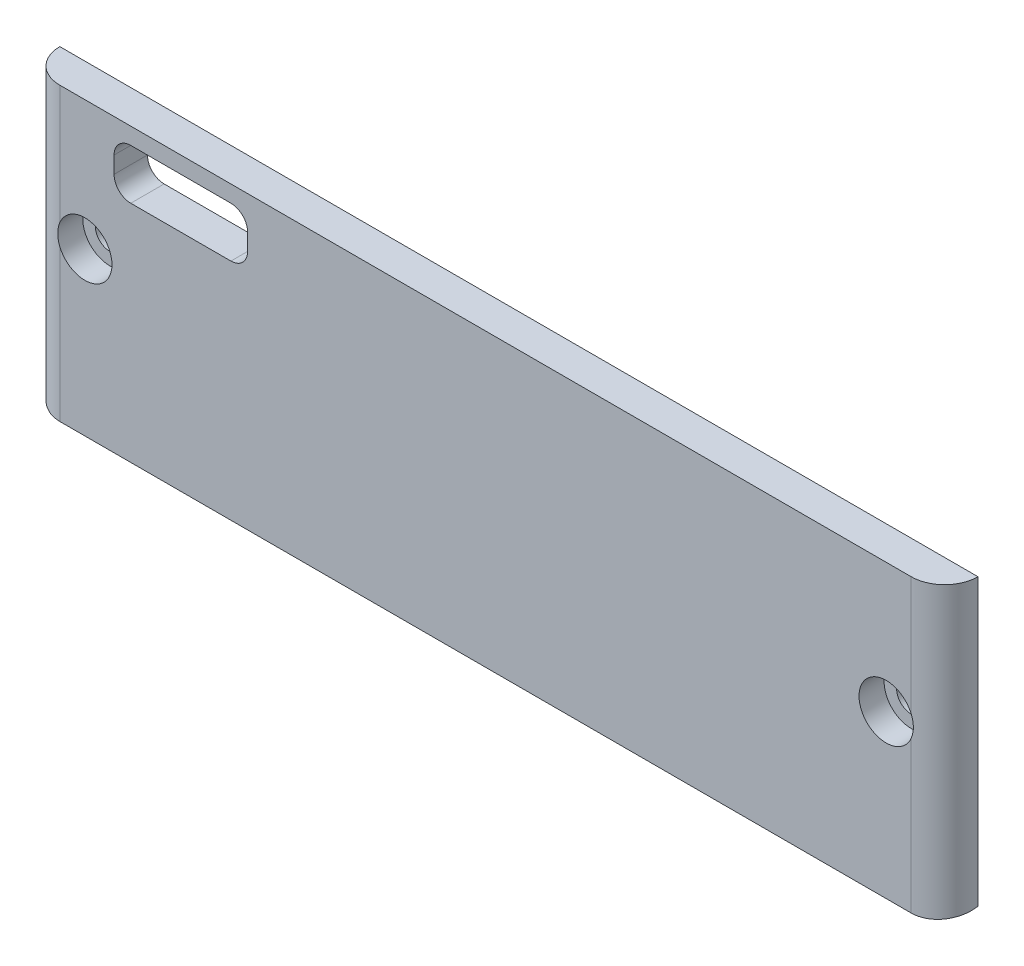
from build123d import *

# Parameters (mm, degrees)
ESQUISSE1_W             = 110
ESQUISSE1_H             = 34.19
BOSS_EXTRU_1_DEPTH      = 4
BOSS_EXTRU_2_DEPTH      = 110
ESQUISSE3_R             = 1.75
ENL_V_MAT_EXTRU_1_DEPTH = 4
ESQUISSE4_R             = 3.25
ENL_V_MAT_EXTRU_2_DEPTH = 3
ENL_V_MAT_EXTRU_3_DEPTH = 4
CONG_1_R                = 4


with BuildPart() as part:
    # Esquisse1 → Boss.-Extru.1 (new body)
    with BuildSketch(Plane.XY):
        with Locations((55, 17.095)):
            Rectangle(ESQUISSE1_W, ESQUISSE1_H)
    extrude(amount=BOSS_EXTRU_1_DEPTH)

    # Esquisse2 → Boss.-Extru.2 (add)
    with BuildSketch(Plane(origin=(110, 0, 0), x_dir=(0, 0, -1), z_dir=(1, 0, 0))):
        Polygon((0, 0), (-4, 0), (-4, -0.705307923), align=None)
    extrude(amount=-BOSS_EXTRU_2_DEPTH)

    # Esquisse3 → Enlèv. mat.-Extru.1 (cut)
    with BuildSketch(Plane.XY.offset(4)):
        with Locations((7, 18.69)):
            Circle(ESQUISSE3_R)
        with Locations((103, 18.69)):
            Circle(ESQUISSE3_R)
    extrude(amount=-ENL_V_MAT_EXTRU_1_DEPTH, mode=Mode.SUBTRACT)

    # Esquisse4 → Enlèv. mat.-Extru.2 (cut)
    with BuildSketch(Plane.XY.offset(4)):
        with Locations((7, 18.69)):
            Circle(ESQUISSE4_R)
        with Locations((103, 18.69)):
            Circle(ESQUISSE4_R)
    extrude(amount=-ENL_V_MAT_EXTRU_2_DEPTH, mode=Mode.SUBTRACT)

    # Esquisse5 → Enlèv. mat.-Extru.3 (cut)
    with BuildSketch(Plane.XY.offset(4)):
        with BuildLine():
            Line((12.5, 32.19), (24.5, 32.19))
            ThreePointArc((24.5, 32.19), (25.914213562, 31.604213562), (26.5, 30.19))
            Line((26.5, 30.19), (26.5, 28.19))
            ThreePointArc((26.5, 28.19), (25.914213562, 26.775786438), (24.5, 26.19))
            Line((24.5, 26.19), (12.5, 26.19))
            ThreePointArc((12.5, 26.19), (11.085786438, 26.775786438), (10.5, 28.19))
            Line((10.5, 28.19), (10.5, 30.19))
            ThreePointArc((10.5, 30.19), (11.085786438, 31.604213562), (12.5, 32.19))
        make_face()
    extrude(amount=-ENL_V_MAT_EXTRU_3_DEPTH, mode=Mode.SUBTRACT)

    # Congé1
    # the kernel refuses this fillet: 4 mm, written as the material it takes off along each edge
    with BuildSketch(Plane(origin=(0, 44.19, 4), x_dir=(1, 0, 0), z_dir=(0, -1, 0)), Plane(origin=(110, 44.19, 4), x_dir=(0, 0, -1), z_dir=(0, -1, 0))) as cong_1_piece_1:
        with BuildLine():
            CenterArc((CONG_1_R, -CONG_1_R), CONG_1_R, 90, 90)
            Line((0, -CONG_1_R), (0, 0))
            Line((0, 0), (CONG_1_R, 0))
        make_face()
    extrude(amount=54.895307923, mode=Mode.SUBTRACT)


solid = part.part
